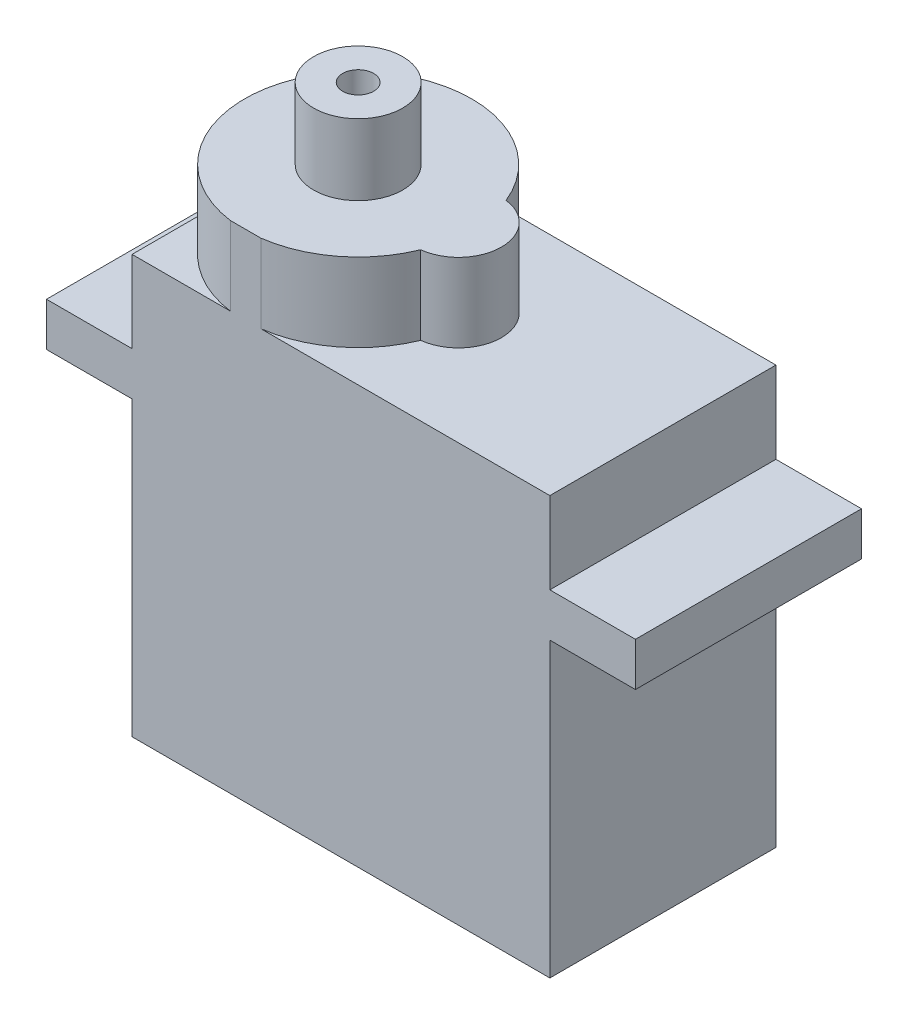
from build123d import *

# Parameters (mm, degrees)
SKETCH1_W           = 22.36
SKETCH1_H           = 22.36
BOSS_EXTRUDE1_DEPTH = 12.1
SKETCH2_W           = 12.1
SKETCH2_H           = 2.33
BOSS_EXTRUDE2_DEPTH = 4.58
SKETCH5_W           = 12.1
SKETCH5_H           = 2.33
BOSS_EXTRUDE5_DEPTH = 4.58
BOSS_EXTRUDE6_DEPTH = 4.2
SKETCH8_R           = 2.385
BOSS_EXTRUDE7_DEPTH = 3.8
SKETCH9_R           = 0.83
CUT_EXTRUDE1_DEPTH  = 4.05


with BuildPart() as part:
    # Sketch1 → Boss-Extrude1 (new body)
    with BuildSketch(Plane.XY):
        with Locations((-5.608652168, 8.135529225)):
            Rectangle(SKETCH1_W, SKETCH1_H)
    extrude(amount=BOSS_EXTRUDE1_DEPTH)

    # Sketch2 → Boss-Extrude2 (add)
    with BuildSketch(Plane(origin=(5.571347832, 0, 0), x_dir=(0, 0, -1), z_dir=(1, 0, 0))):
        with Locations((-6.05, 13.780529225)):
            Rectangle(SKETCH2_W, SKETCH2_H)
    extrude(amount=BOSS_EXTRUDE2_DEPTH)

    # Sketch5 → Boss-Extrude5 (add)
    with BuildSketch(Plane.ZY.offset(16.788652168)):
        with Locations((6.05, 13.780529225)):
            Rectangle(SKETCH5_W, SKETCH5_H)
    extrude(amount=BOSS_EXTRUDE5_DEPTH)

    # Sketch7 → Boss-Extrude6 (add)
    with BuildSketch(Plane(origin=(0, 19.315529225, 0), x_dir=(1, 0, 0), z_dir=(0, 1, 0))):
        with BuildLine():
            ThreePointArc((-9.897920923, -12.1), (-6.986239291, -10.879200877), (-5.079928854, -8.362413056))
            ThreePointArc((-5.079928854, -8.362413056), (-3.041533741, -6.077339122), (-5.079928854, -3.792265188))
            ThreePointArc((-5.079928854, -3.792265188), (-15.513174802, -2.352265367), (-11.524705169, -12.1))
            Line((-11.524705169, -12.1), (-9.897920923, -12.1))
        make_face()
    extrude(amount=BOSS_EXTRUDE6_DEPTH)

    # Sketch8 → Boss-Extrude7 (add)
    with BuildSketch(Plane(origin=(0, 23.515529225, 0), x_dir=(1, 0, 0), z_dir=(0, 1, 0))):
        with Locations((-10.711313046, -6.077339122)):
            Circle(SKETCH8_R)
    extrude(amount=BOSS_EXTRUDE7_DEPTH)

    # Sketch9 → Cut-Extrude1 (cut)
    with BuildSketch(Plane(origin=(0, 27.315529225, 0), x_dir=(1, 0, 0), z_dir=(0, 1, 0))):
        with Locations((-10.711313046, -6.077339122)):
            Circle(SKETCH9_R)
    extrude(amount=-CUT_EXTRUDE1_DEPTH, mode=Mode.SUBTRACT)


solid = part.part
